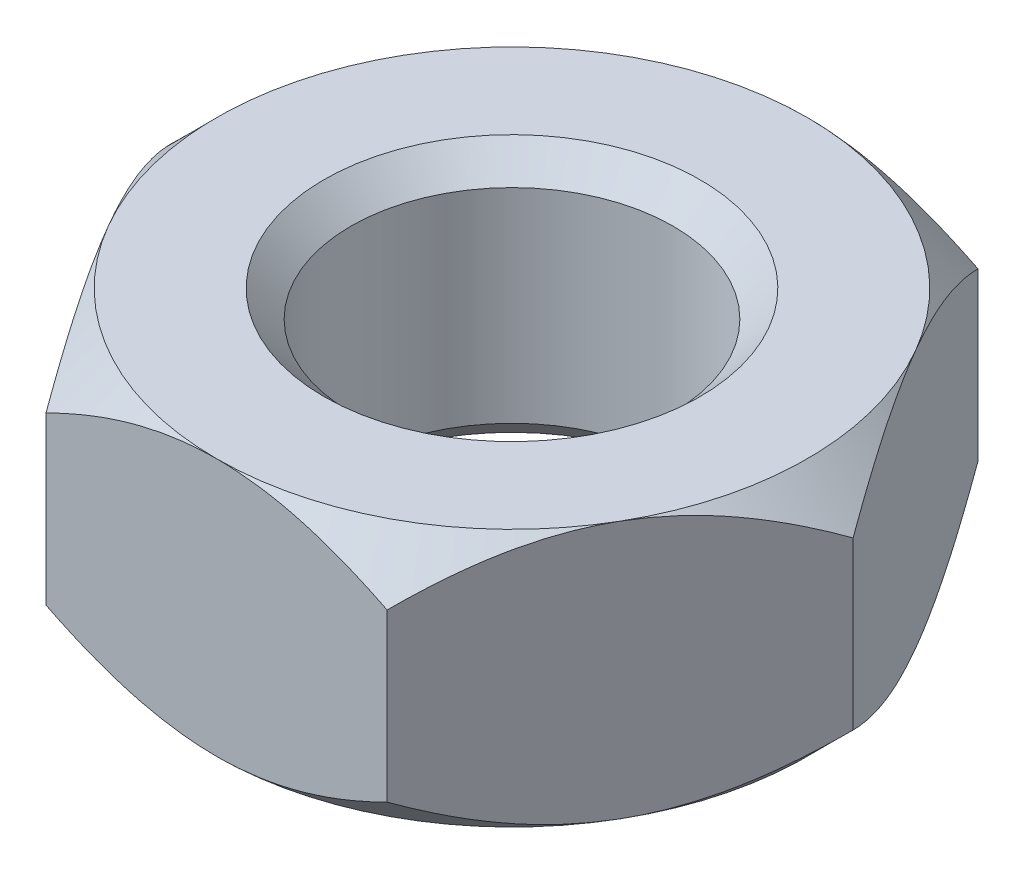
from build123d import *

# Parameters (mm, degrees)
SKETCH1_R           = 1.5
BOSS_EXTRUDE1_DEPTH = 2.4
CHAMFER2_SIZE       = 0.25


with BuildPart() as part:
    # Sketch1 → Boss-Extrude1 (new body)
    with BuildSketch(Plane(origin=(0, 0, 0), x_dir=(1, 0, 0), z_dir=(0, 1, 0))):
        Polygon((1.58771324, -2.75), (3.175426481, 0), (1.58771324, 2.75), (-1.58771324, 2.75), (-3.175426481, 0), (-1.58771324, -2.75), align=None)
        Circle(SKETCH1_R, mode=Mode.SUBTRACT)
    extrude(amount=BOSS_EXTRUDE1_DEPTH)

    # Sketch2 → Cut-Revolve1 (revolve, cut)
    with BuildSketch(Plane(origin=(0, 0, 0), x_dir=(0, 0, -1), z_dir=(1, 0, 0))):
        Polygon((2.75, 2.4), (3.8, 3.45), (3.8, 1.35), align=None)
        Polygon((3.8, 1.05), (2.75, 0), (3.8, -1.05), align=None)
    revolve(axis=Axis((0, 2.4, 0), (0, -1, 0)), mode=Mode.SUBTRACT)

    # Chamfer2
    chamfer2_edges = [part.edges().sort_by_distance(p)[0] for p in [
        (-1.5, 2.4, 0),
        (-1.5, 0, 0),
    ]]
    chamfer(chamfer2_edges, length=CHAMFER2_SIZE)


solid = part.part
